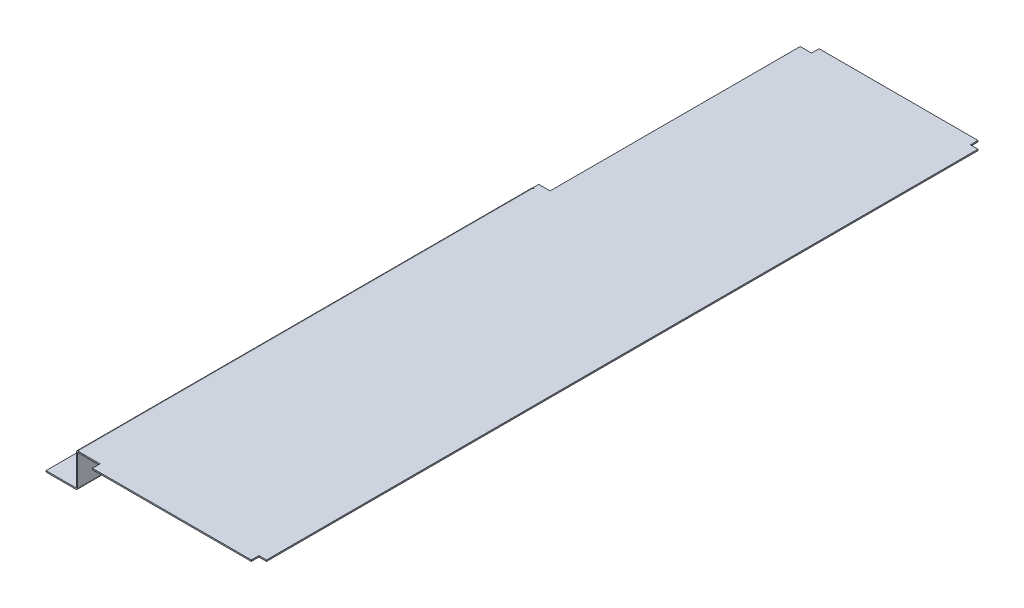
from build123d import *

# Parameters (mm, degrees)
BASE_FLANGE1_DEPTH            = 1.7366
EDGE_FLANGE1_STRIP_W          = 8.4196
EDGE_FLANGE1_STRIP_H          = 1.7366
EDGE_FLANGE1_STRIP_CUT_DEPTH  = 600.1
EDGE_FLANGE1_RELIEF_W         = 9.2879
EDGE_FLANGE1_RELIEF_H         = 0.8683
EDGE_FLANGE1_RELIEF_CUT_DEPTH = 1.7366
EDGE_FLANGE1_DEPTH            = 600.1
EDGE_FLANGE2_STRIP_W          = 8.4196
EDGE_FLANGE2_STRIP_H          = 1.7366
EDGE_FLANGE2_STRIP_CUT_DEPTH  = 544.6
EDGE_FLANGE2_RELIEF_W         = 9.2879
EDGE_FLANGE2_RELIEF_H         = 0.8683
EDGE_FLANGE2_RELIEF_CUT_DEPTH = 1.7366
EDGE_FLANGE2_DEPTH            = 544.6


# Sheet-metal steps are written as plain solids
with BuildPart() as part:
    # Sketch1 → Base-Flange1 (new body)
    with BuildSketch(Plane(origin=(0, 0, 0), x_dir=(1, 0, 0), z_dir=(0, 1, 0))):
        Polygon((-105.270941838, 479.5), (-105.270941838, 469.5), (-120.270941838, 469.5), (-120.270941838, 139.5), (-135.270941838, 139.5), (-135.270941838, -469.5), (-120.270941838, -469.5), (-105.270941838, -469.5), (-105.270941838, -479.5), (104.429058162, -479.5), (104.429058162, -469.5), (114.429058162, -469.5), (114.429058162, 469.5), (104.429058162, 469.5), (104.429058162, 479.5), align=None)
    extrude(amount=-BASE_FLANGE1_DEPTH)

    # Edge-Flange1 strip (across the edge) → Edge-Flange1 strip cut (cut)
    with BuildSketch(Plane(origin=(-135.270941838, -1.7366, 469.1), x_dir=(1, 0, 0), z_dir=(0, 0, -1))):
        with Locations((-3.4732, -0.8683)):
            Rectangle(EDGE_FLANGE1_STRIP_W, EDGE_FLANGE1_STRIP_H)
    extrude(amount=EDGE_FLANGE1_STRIP_CUT_DEPTH, mode=Mode.SUBTRACT)

    # Edge-Flange1 relief (on the sheet) → Edge-Flange1 relief cut (cut)
    with BuildSketch(Plane(origin=(-134.534341838, -1.7366, 469.1), x_dir=(1, 0, 0), z_dir=(0, -1, 0))):
        with Locations((-3.77565, 0.43415)):
            Rectangle(EDGE_FLANGE1_RELIEF_W, EDGE_FLANGE1_RELIEF_H)
        with Locations((-3.77565, -600.53415)):
            Rectangle(EDGE_FLANGE1_RELIEF_W, EDGE_FLANGE1_RELIEF_H)
    extrude(amount=-EDGE_FLANGE1_RELIEF_CUT_DEPTH, mode=Mode.SUBTRACT)

    # Edge-Flange1 section (across the edge) → Edge-Flange1 (add)
    with BuildSketch(Plane(origin=(-135.270941838, -1.7366, 469.1), x_dir=(1, 0, 0), z_dir=(0, 0, -1))):
        with BuildLine():
            Line((-1.7366, 0.7366), (-1.7366, 42))
            Line((-1.7366, 42), (0, 42))
            Line((0, 42), (0, 0.7366))
            ThreePointArc((0, 0.7366), (0.215745145, 0.215745145), (0.7366, 0))
            Line((0.7366, 0), (0.7366, -1.7366))
            ThreePointArc((0.7366, -1.7366), (-1.012216491, -1.012216491), (-1.7366, 0.7366))
        make_face()
    extrude(amount=EDGE_FLANGE1_DEPTH)

    # Edge-Flange2 strip (across the edge) → Edge-Flange2 strip cut (cut)
    with BuildSketch(Plane(origin=(-137.007541838, -43.7366, -75.5), x_dir=(0, 1, 0), z_dir=(0, 0, 1))):
        with Locations((-3.4732, -0.8683)):
            Rectangle(EDGE_FLANGE2_STRIP_W, EDGE_FLANGE2_STRIP_H)
    extrude(amount=EDGE_FLANGE2_STRIP_CUT_DEPTH, mode=Mode.SUBTRACT)

    # Edge-Flange2 relief (on the sheet) → Edge-Flange2 relief cut (cut)
    with BuildSketch(Plane(origin=(-137.007541838, -43, -75.5), x_dir=(0, 1, 0), z_dir=(-1, 0, 0))):
        with Locations((-3.77565, 0.43415)):
            Rectangle(EDGE_FLANGE2_RELIEF_W, EDGE_FLANGE2_RELIEF_H)
    extrude(amount=-EDGE_FLANGE2_RELIEF_CUT_DEPTH, mode=Mode.SUBTRACT)

    # Edge-Flange2 section (across the edge) → Edge-Flange2 (add)
    with BuildSketch(Plane(origin=(-137.007541838, -43.7366, -75.5), x_dir=(0, 1, 0), z_dir=(0, 0, 1))):
        with BuildLine():
            Line((-1.7366, 0.7366), (-1.7366, 40))
            Line((-1.7366, 40), (0, 40))
            Line((0, 40), (0, 0.7366))
            ThreePointArc((0, 0.7366), (0.215745145, 0.215745145), (0.7366, 0))
            Line((0.7366, 0), (0.7366, -1.7366))
            ThreePointArc((0.7366, -1.7366), (-1.012216491, -1.012216491), (-1.7366, 0.7366))
        make_face()
    extrude(amount=EDGE_FLANGE2_DEPTH)


solid = part.part
